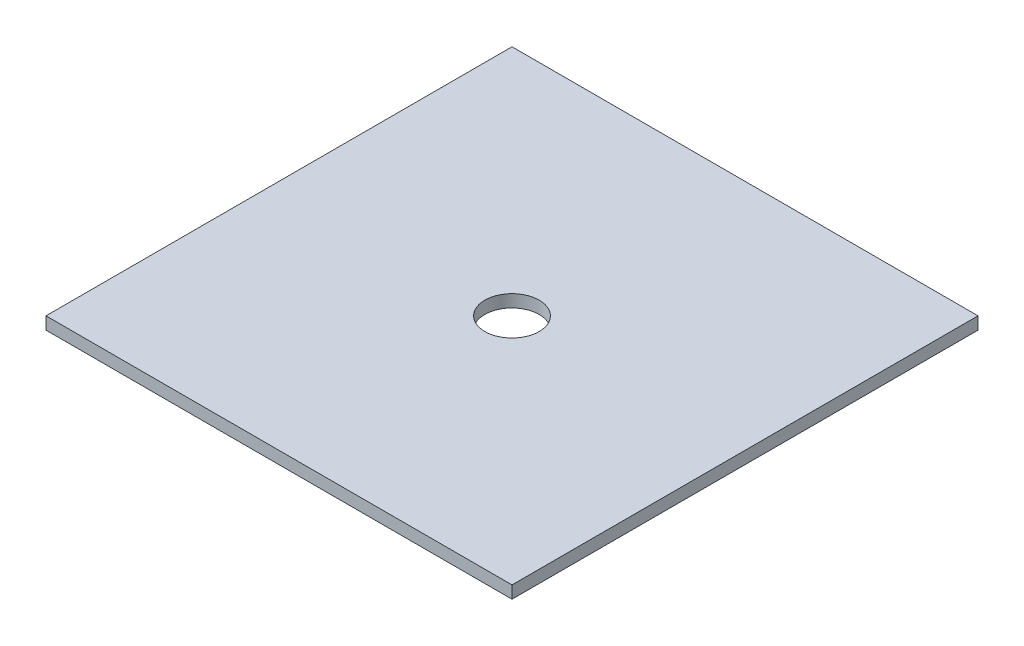
from build123d import *

# Parameters (mm, degrees)
ESQUISSE1_W                  = 300
ESQUISSE1_H                  = 300
BOSS_EXTRU_1_DEPTH           = 8
ENL_V_MAT_EXTRU_1_DEPTH      = 213.282830205
ENL_V_MAT_EXTRU_1_DEPTH_BACK = 213.282830205
ESQUISSE2_R                  = 17.5


with BuildPart() as part:
    # Esquisse1 → Boss.-Extru.1 (new body)
    with BuildSketch(Plane(origin=(0, 0, 0), x_dir=(1, 0, 0), z_dir=(0, 1, 0))):
        Rectangle(ESQUISSE1_W, ESQUISSE1_H)
    extrude(amount=BOSS_EXTRU_1_DEPTH)

    # Esquisse2 → Enlèv. mat.-Extru.1 (cut, two sides: drawn at the far end of the back side and taken through both)
    with BuildSketch(Plane(origin=(0, 8, 0), x_dir=(1, 0, 0), z_dir=(0, 1, 0)).offset(-ENL_V_MAT_EXTRU_1_DEPTH_BACK)):
        Circle(ESQUISSE2_R)
    extrude(amount=ENL_V_MAT_EXTRU_1_DEPTH + ENL_V_MAT_EXTRU_1_DEPTH_BACK, mode=Mode.SUBTRACT)


solid = part.part
